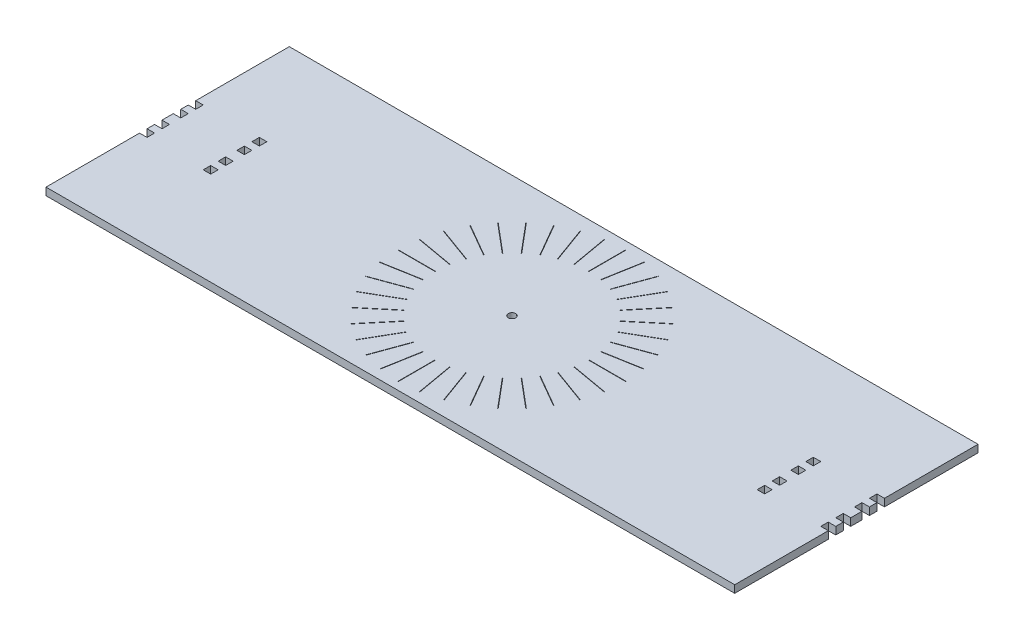
from build123d import *

# Parameters (mm, degrees)
SKETCH1_W           = 467.36
SKETCH1_H           = 165.1
SKETCH1_R           = 2.54
BOSS_EXTRUDE1_DEPTH = 5.08
SKETCH2_W           = 5.08
SKETCH2_H           = 5.08
CUT_EXTRUDE1_DEPTH  = 5.08
SKETCH3_W           = 0.254
SKETCH3_H           = 25.4
SKETCH3_W_2         = 25.4
SKETCH3_H_2         = 0.254
CUT_EXTRUDE2_DEPTH  = 5.08


with BuildPart() as part:
    # Sketch1 → Boss-Extrude1 (new body)
    with BuildSketch(Plane(origin=(0, 0, 0), x_dir=(1, 0, 0), z_dir=(0, 1, 0))):
        with Locations((5.098472727, 5.398654545)):
            Rectangle(SKETCH1_W, SKETCH1_H)
        with Locations((5.098472727, 5.398654545)):
            Circle(SKETCH1_R, mode=Mode.SUBTRACT)
    extrude(amount=BOSS_EXTRUDE1_DEPTH)

    # Sketch2 → Cut-Extrude1 (cut)
    with BuildSketch(Plane(origin=(0, 5.08, 0), x_dir=(1, 0, 0), z_dir=(0, 1, 0))):
        with Locations((-226.041527273, 21.908654545)):
            Rectangle(SKETCH2_W, SKETCH2_H)
        with Locations((-226.041527273, -11.111345455)):
            Rectangle(SKETCH2_W, SKETCH2_H)
        with Locations((-226.041527273, 11.748654545)):
            Rectangle(SKETCH2_W, SKETCH2_H)
        with Locations((-226.041527273, -0.951345455)):
            Rectangle(SKETCH2_W, SKETCH2_H)
        with Locations((-182.861527273, 21.908654545)):
            Rectangle(SKETCH2_W, SKETCH2_H)
        with Locations((-182.861527273, -0.951345455)):
            Rectangle(SKETCH2_W, SKETCH2_H)
        with Locations((-182.861527273, -11.111345455)):
            Rectangle(SKETCH2_W, SKETCH2_H)
        with Locations((-182.861527273, 11.748654545)):
            Rectangle(SKETCH2_W, SKETCH2_H)
        with Locations((193.058472727, 11.748654545)):
            Rectangle(SKETCH2_W, SKETCH2_H)
        with Locations((193.058472727, -11.111345455)):
            Rectangle(SKETCH2_W, SKETCH2_H)
        with Locations((193.058472727, -0.951345455)):
            Rectangle(SKETCH2_W, SKETCH2_H)
        with Locations((193.058472727, 21.908654545)):
            Rectangle(SKETCH2_W, SKETCH2_H)
        with Locations((236.238472727, -0.951345455)):
            Rectangle(SKETCH2_W, SKETCH2_H)
        with Locations((236.238472727, 11.748654545)):
            Rectangle(SKETCH2_W, SKETCH2_H)
        with Locations((236.238472727, -11.111345455)):
            Rectangle(SKETCH2_W, SKETCH2_H)
        with Locations((236.238472727, 21.908654545)):
            Rectangle(SKETCH2_W, SKETCH2_H)
    extrude(amount=-CUT_EXTRUDE1_DEPTH, mode=Mode.SUBTRACT)

    # Sketch3 → Cut-Extrude2 (cut)
    with BuildSketch(Plane(origin=(0, 5.08, 0), x_dir=(1, 0, 0), z_dir=(0, 1, 0))):
        Polygon((18.425926466, 81.71376449), (18.676067636, 81.669657853), (14.265403923, 56.655540926), (14.015262754, 56.699647563), align=None)
        with Locations((5.098472727, 70.168654545)):
            Rectangle(SKETCH3_W, SKETCH3_H)
        Polygon((31.475432268, 78.240078436), (31.714114194, 78.15320532), (23.026802553, 54.285012752), (22.788120627, 54.371885868), align=None)
        Polygon((43.723487501, 72.553142577), (43.943457954, 72.426142577), (31.243457954, 50.429097321), (31.023487501, 50.556097321), align=None)
        Polygon((54.797941205, 64.82575158), (54.992516494, 64.662483527), (38.665711208, 45.204954672), (38.471135919, 45.368222725), align=None)
        Polygon((64.362301709, 55.292698312), (64.525569762, 55.098123024), (45.068040907, 38.771317738), (44.904772854, 38.965893026), align=None)
        Polygon((72.125960758, 44.243639772), (72.252960758, 44.023669319), (50.255915502, 31.323669319), (50.128915502, 31.543639772), align=None)
        Polygon((77.853023501, 32.014296012), (77.939896618, 31.775614086), (54.07170405, 23.088302446), (53.984830933, 23.326984371), align=None)
        Polygon((81.369476035, 18.976249454), (81.413582672, 18.726108285), (56.399465745, 14.315444572), (56.355359108, 14.565585741), align=None)
        with Locations((69.868472727, 5.398654545)):
            Rectangle(SKETCH3_W_2, SKETCH3_H_2)
        Polygon((81.413582672, -7.928799194), (81.369476035, -8.178940363), (56.355359108, -3.76827665), (56.399465745, -3.518135481), align=None)
        Polygon((77.939896618, -20.978304995), (77.853023501, -21.216986921), (53.984830933, -12.52967528), (54.07170405, -12.290993355), align=None)
        Polygon((72.252960758, -33.226360228), (72.125960758, -33.446330681), (50.128915502, -20.746330681), (50.255915502, -20.526360228), align=None)
        Polygon((64.525569762, -44.300813933), (64.362301709, -44.495389221), (44.904772854, -28.168583935), (45.068040907, -27.974008647), align=None)
        Polygon((54.992516494, -53.865174437), (54.797941205, -54.028442489), (38.471135919, -34.570913634), (38.665711208, -34.407645581), align=None)
        Polygon((43.943457954, -61.628833486), (43.723487501, -61.755833486), (31.023487501, -39.75878823), (31.243457954, -39.63178823), align=None)
        Polygon((31.714114194, -67.355896229), (31.475432268, -67.442769345), (22.788120627, -43.574576777), (23.026802553, -43.487703661), align=None)
        Polygon((18.676067636, -70.872348762), (18.425926466, -70.916455399), (14.015262754, -45.902338472), (14.265403923, -45.858231835), align=None)
        with Locations((5.098472727, -59.371345455)):
            Rectangle(SKETCH3_W, SKETCH3_H)
        Polygon((-8.228981012, -70.916455399), (-8.479122181, -70.872348762), (-4.068458468, -45.858231835), (-3.818317299, -45.902338472), align=None)
        Polygon((-21.278486813, -67.442769345), (-21.517168739, -67.355896229), (-12.829857099, -43.487703661), (-12.591175173, -43.574576777), align=None)
        Polygon((-33.526542046, -61.755833486), (-33.746512499, -61.628833486), (-21.046512499, -39.63178823), (-20.826542046, -39.75878823), align=None)
        Polygon((-44.600995751, -54.028442489), (-44.795571039, -53.865174437), (-28.468765753, -34.407645581), (-28.274190465, -34.570913634), align=None)
        Polygon((-54.165356255, -44.495389221), (-54.328624308, -44.300813933), (-34.871095452, -27.974008647), (-34.7078274, -28.168583935), align=None)
        Polygon((-61.929015304, -33.446330681), (-62.056015304, -33.226360228), (-40.058970048, -20.526360228), (-39.931970048, -20.746330681), align=None)
        Polygon((-67.656078047, -21.216986921), (-67.742951163, -20.978304995), (-43.874758595, -12.290993355), (-43.787885479, -12.52967528), align=None)
        Polygon((-71.17253058, -8.178940363), (-71.216637217, -7.928799194), (-46.202520291, -3.518135481), (-46.158413654, -3.76827665), align=None)
        with Locations((-59.671527273, 5.398654545)):
            Rectangle(SKETCH3_W_2, SKETCH3_H_2)
        Polygon((-71.216637217, 18.726108285), (-71.17253058, 18.976249454), (-46.158413654, 14.565585741), (-46.202520291, 14.315444572), align=None)
        Polygon((-67.742951163, 31.775614086), (-67.656078047, 32.014296012), (-43.787885479, 23.326984371), (-43.874758595, 23.088302446), align=None)
        Polygon((-62.056015304, 44.023669319), (-61.929015304, 44.243639772), (-39.931970048, 31.543639772), (-40.058970048, 31.323669319), align=None)
        Polygon((-54.328624308, 55.098123024), (-54.165356255, 55.292698312), (-34.7078274, 38.965893026), (-34.871095452, 38.771317738), align=None)
        Polygon((-44.795571039, 64.662483527), (-44.600995751, 64.82575158), (-28.274190465, 45.368222725), (-28.468765753, 45.204954672), align=None)
        Polygon((-33.746512499, 72.426142577), (-33.526542046, 72.553142577), (-20.826542046, 50.556097321), (-21.046512499, 50.429097321), align=None)
        Polygon((-21.517168739, 78.15320532), (-21.278486813, 78.240078436), (-12.591175173, 54.371885868), (-12.829857099, 54.285012752), align=None)
        Polygon((-8.479122181, 81.669657853), (-8.228981012, 81.71376449), (-3.818317299, 56.699647563), (-4.068458468, 56.655540926), align=None)
    extrude(amount=-CUT_EXTRUDE2_DEPTH, mode=Mode.SUBTRACT)


solid = part.part
